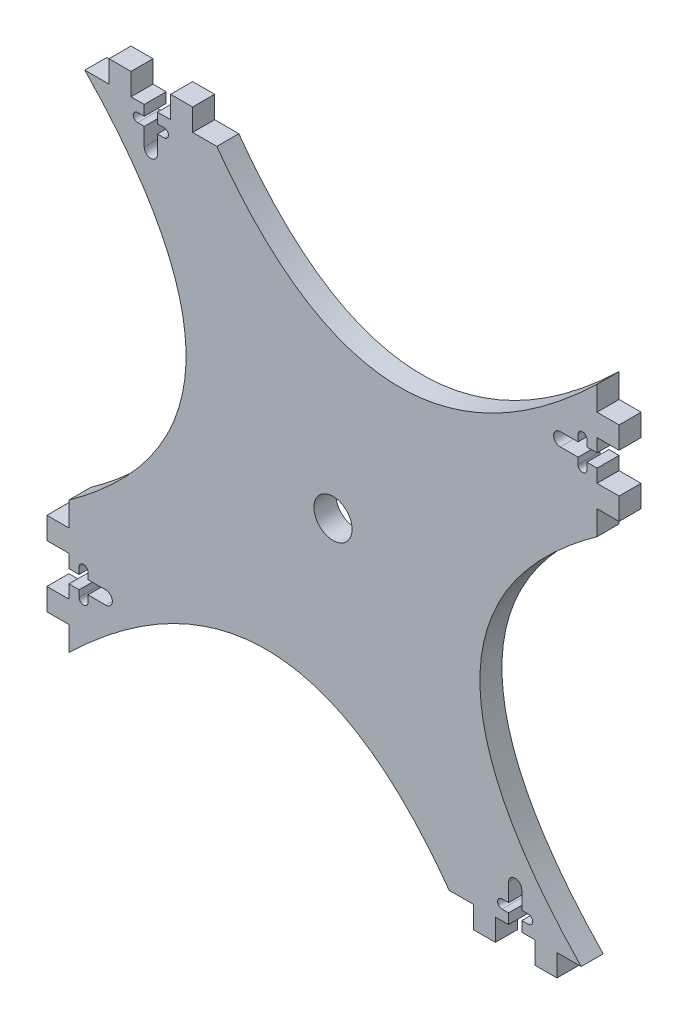
from build123d import *

# Parameters (mm, degrees)
SKETCH1_R           = 4.336992443
BOSS_EXTRUDE1_DEPTH = 5
SKETCH2_OUTSIDE_W   = 155.956
SKETCH2_OUTSIDE_H   = 155.956
CUT_EXTRUDE1_DEPTH  = 10
SKETCH3_W           = 5
SKETCH3_H           = 5
BOSS_EXTRUDE2_DEPTH = 5


with BuildPart() as part:
    # Sketch1 → Boss-Extrude1 (new body)
    with BuildSketch(Plane.XY):
        with BuildLine():
            Line((-16.674721166, 52.5), (-46.674721166, 52.5))
            add(Edge.make_bspline(
                [(-46.674721166, 52.5), (1.078343639, 2.985334424), (-50.285, -33.889721166)],
                knots=[0, 0, 0, 1, 1, 1], degree=2))
            Line((-50.285, -33.889721166), (-50.285, -63.889721166))
            add(Edge.make_bspline(
                [(-50.285, -63.889721166), (-0.770334424, -16.136656361), (36.104721166, -67.5)],
                knots=[0, 0, 0, 1, 1, 1], degree=2))
            Line((36.104721166, -67.5), (66.104721166, -67.5))
            add(Edge.make_bspline(
                [(66.104721166, -67.5), (18.351656361, -17.985334424), (69.715, 18.889721166)],
                knots=[0, 0, 0, 1, 1, 1], degree=2))
            Line((69.715, 18.889721166), (69.715, 48.889721166))
            add(Edge.make_bspline(
                [(69.715, 48.889721166), (20.200334424, 1.136656361), (-16.674721166, 52.5)],
                knots=[0, 0, 0, 1, 1, 1], degree=2))
        make_face()
        with Locations((9.715, -7.5)):
            Circle(SKETCH1_R, mode=Mode.SUBTRACT)
    extrude(amount=BOSS_EXTRUDE1_DEPTH)

    # Sketch2 outside → Cut-Extrude1 (cut)
    with BuildSketch(Plane.XY.offset(5)):
        with Locations((9.715, -7.5)):
            Rectangle(SKETCH2_OUTSIDE_W, SKETCH2_OUTSIDE_H)
        with BuildLine():
            Line((-33.174721166, 50.180974538), (-33.174721166, 52.5))
            Line((-33.174721166, 52.500000001), (-46.674721166, 52.5))
            add(Edge.make_bspline(
                [(-46.674721166, 52.5), (1.07834364, 2.985334423), (-50.285000002, -33.889721168)],
                knots=[0, 0, 0, 1, 1, 1], degree=2))
            Line((-50.285000002, -33.889721168), (-50.285000001, -47.389721166))
            Line((-50.285, -47.389721166), (-47.965974538, -47.389721166))
            Line((-47.965974538, -47.389721166), (-47.965974538, -45.889721166))
            ThreePointArc((-47.965974538, -45.889721166), (-46.965974538, -44.889721166), (-45.965974538, -45.889721166))
            Line((-45.965974538, -45.889721166), (-45.965974538, -47.389721166))
            Line((-45.965974538, -47.389721166), (-41.920467471, -47.389721166))
            ThreePointArc((-41.920467471, -47.389721166), (-40.420467471, -48.889721166), (-41.920467471, -50.389721166))
            Line((-41.920467471, -50.389721166), (-45.965974538, -50.389721166))
            Line((-45.965974538, -50.389721166), (-45.965974538, -51.889721166))
            ThreePointArc((-45.965974538, -51.889721166), (-46.965974538, -52.889721166), (-47.965974538, -51.889721166))
            Line((-47.965974538, -51.889721166), (-47.965974538, -50.389721166))
            Line((-47.965974538, -50.389721166), (-50.285, -50.389721166))
            Line((-50.285000001, -50.389721166), (-50.285, -63.889721166))
            add(Edge.make_bspline(
                [(-50.285, -63.889721166), (-0.770334423, -16.13665636), (36.104721168, -67.500000002)],
                knots=[0, 0, 0, 1, 1, 1], degree=2))
            Line((36.104721168, -67.500000002), (49.604721166, -67.500000001))
            Line((49.604721166, -67.5), (49.604721166, -65.180974538))
            Line((49.604721166, -65.180974538), (48.104721166, -65.180974538))
            ThreePointArc((48.104721166, -65.180974538), (47.104721166, -64.180974538), (48.104721166, -63.180974538))
            Line((48.104721166, -63.180974538), (49.604721166, -63.180974538))
            Line((49.604721166, -63.180974538), (49.604721166, -59.135467471))
            ThreePointArc((49.604721166, -59.135467471), (51.104721166, -57.635467471), (52.604721166, -59.135467471))
            Line((52.604721166, -59.135467471), (52.604721166, -63.180974538))
            Line((52.604721166, -63.180974538), (54.104721166, -63.180974538))
            ThreePointArc((54.104721166, -63.180974538), (55.104721166, -64.180974538), (54.104721166, -65.180974538))
            Line((54.104721166, -65.180974538), (52.604721166, -65.180974538))
            Line((52.604721166, -65.180974538), (52.604721166, -67.5))
            Line((52.604721166, -67.500000001), (66.104721166, -67.5))
            add(Edge.make_bspline(
                [(66.104721166, -67.5), (18.351656361, -17.985334424), (69.715, 18.889721166)],
                knots=[0, 0, 0, 1, 1, 1], degree=2))
            Line((69.715, 18.889721166), (69.715, 32.389721166))
            Line((69.715, 32.389721166), (67.395974538, 32.389721166))
            Line((67.395974538, 32.389721166), (67.395974538, 30.889721166))
            ThreePointArc((67.395974538, 30.889721166), (66.395974538, 29.889721166), (65.395974538, 30.889721166))
            Line((65.395974538, 30.889721166), (65.395974538, 32.389721166))
            Line((65.395974538, 32.389721166), (61.350467471, 32.389721166))
            ThreePointArc((61.350467471, 32.389721166), (59.850467471, 33.889721166), (61.350467471, 35.389721166))
            Line((61.350467471, 35.389721166), (65.395974538, 35.389721166))
            Line((65.395974538, 35.389721166), (65.395974538, 36.889721166))
            ThreePointArc((65.395974538, 36.889721166), (66.395974538, 37.889721166), (67.395974538, 36.889721166))
            Line((67.395974538, 36.889721166), (67.395974538, 35.389721166))
            Line((67.395974538, 35.389721166), (69.715, 35.389721166))
            Line((69.715, 35.389721166), (69.715, 48.889721166))
            add(Edge.make_bspline(
                [(69.715, 48.889721166), (20.200334423, 1.13665636), (-16.674721168, 52.500000002)],
                knots=[0, 0, 0, 1, 1, 1], degree=2))
            Line((-16.674721168, 52.500000002), (-30.174721166, 52.500000001))
            Line((-30.174721166, 52.5), (-30.174721166, 50.180974538))
            Line((-30.174721166, 50.180974538), (-28.674721166, 50.180974538))
            ThreePointArc((-28.674721166, 50.180974538), (-27.674721166, 49.180974538), (-28.674721166, 48.180974538))
            Line((-28.674721166, 48.180974538), (-30.174721166, 48.180974538))
            Line((-30.174721166, 48.180974538), (-30.174721166, 44.135467471))
            ThreePointArc((-30.174721166, 44.135467471), (-31.674721166, 42.635467471), (-33.174721166, 44.135467471))
            Line((-33.174721166, 44.135467471), (-33.174721166, 48.180974538))
            Line((-33.174721166, 48.180974538), (-34.674721166, 48.180974538))
            ThreePointArc((-34.674721166, 48.180974538), (-35.674721166, 49.180974538), (-34.674721166, 50.180974538))
            Line((-34.674721166, 50.180974538), (-33.174721166, 50.180974538))
        make_face(mode=Mode.SUBTRACT)
    extrude(amount=-CUT_EXTRUDE1_DEPTH, mode=Mode.SUBTRACT)

    # Sketch3 → Boss-Extrude2 (add)
    with BuildSketch(Plane.XY.offset(5)):
        with Locations((-38.674721166, 55)):
            Rectangle(SKETCH3_W, SKETCH3_H)
        with Locations((-24.674721166, 55)):
            Rectangle(SKETCH3_W, SKETCH3_H)
        with Locations((72.215, 40.889721166)):
            Rectangle(SKETCH3_W, SKETCH3_H)
        with Locations((72.215, 26.889721166)):
            Rectangle(SKETCH3_W, SKETCH3_H)
        with Locations((58.104721166, -70)):
            Rectangle(SKETCH3_W, SKETCH3_H)
        with Locations((44.104721166, -70)):
            Rectangle(SKETCH3_W, SKETCH3_H)
        with Locations((-52.785, -55.889721166)):
            Rectangle(SKETCH3_W, SKETCH3_H)
        with Locations((-52.785, -41.889721166)):
            Rectangle(SKETCH3_W, SKETCH3_H)
    extrude(amount=-BOSS_EXTRUDE2_DEPTH)


solid = part.part
